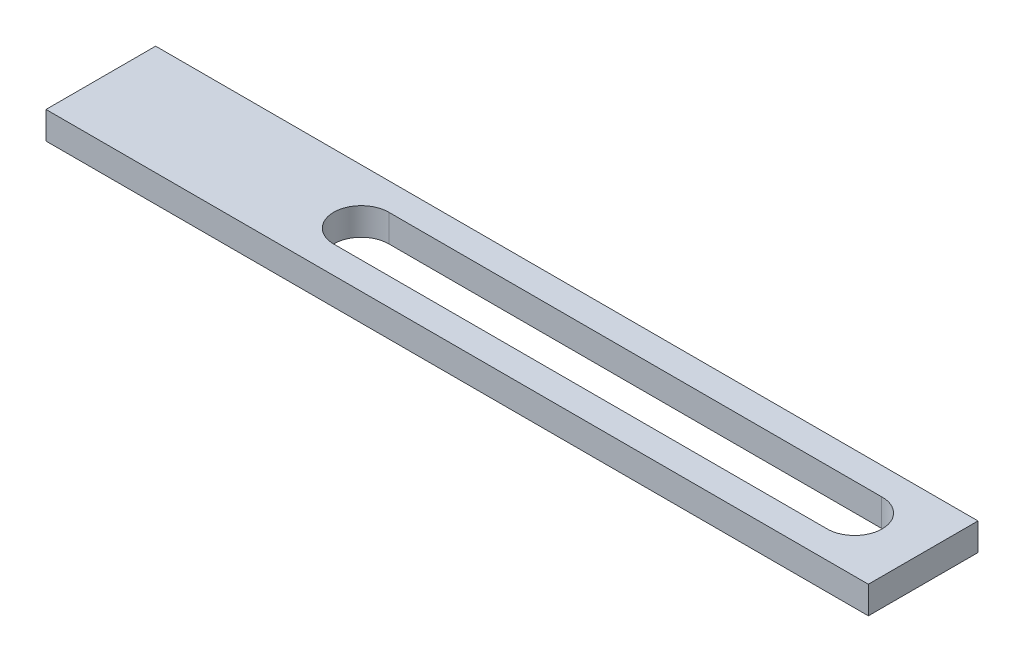
from build123d import *

# Parameters (mm, degrees)
SKETCH_1_W          = 300
SKETCH_1_H          = 40
EXTRUDE_1_DEPTH     = 10
CUT_EXTRUDE_1_REACH = 304.82


with BuildPart() as part:
    # Эскиз1 → Бобышка-Вытянуть1 (new body)
    with BuildSketch(Plane(origin=(0, 0, 0), x_dir=(1, 0, 0), z_dir=(0, 1, 0))):
        with Locations((150, 20)):
            Rectangle(SKETCH_1_W, SKETCH_1_H)
    extrude(amount=EXTRUDE_1_DEPTH)

    # Эскиз2 → Вырез-Вытянуть1 (cut, up to next)
    with BuildSketch(Plane(origin=(0, 10, 0), x_dir=(1, 0, 0), z_dir=(0, 1, 0)), mode=Mode.PRIVATE) as cut_extrude_1_sk1:
        with BuildLine():
            Line((95, 9.95), (274.721446052, 9.953861055))
            ThreePointArc((274.721446052, 9.953861055), (285.05, 20), (274.721446052, 30.046138945))
            Line((274.721446052, 30.046138945), (95, 30.05))
            ThreePointArc((95, 30.05), (84.95, 20), (95, 9.95))
        make_face()
    cut_extrude_1_tool1 = extrude(cut_extrude_1_sk1.sketch, amount=-CUT_EXTRUDE_1_REACH, mode=Mode.PRIVATE) & part.part
    add(cut_extrude_1_tool1.solids().sort_by_distance((184.994726, 10, -20))[0], mode=Mode.SUBTRACT)


solid = part.part
